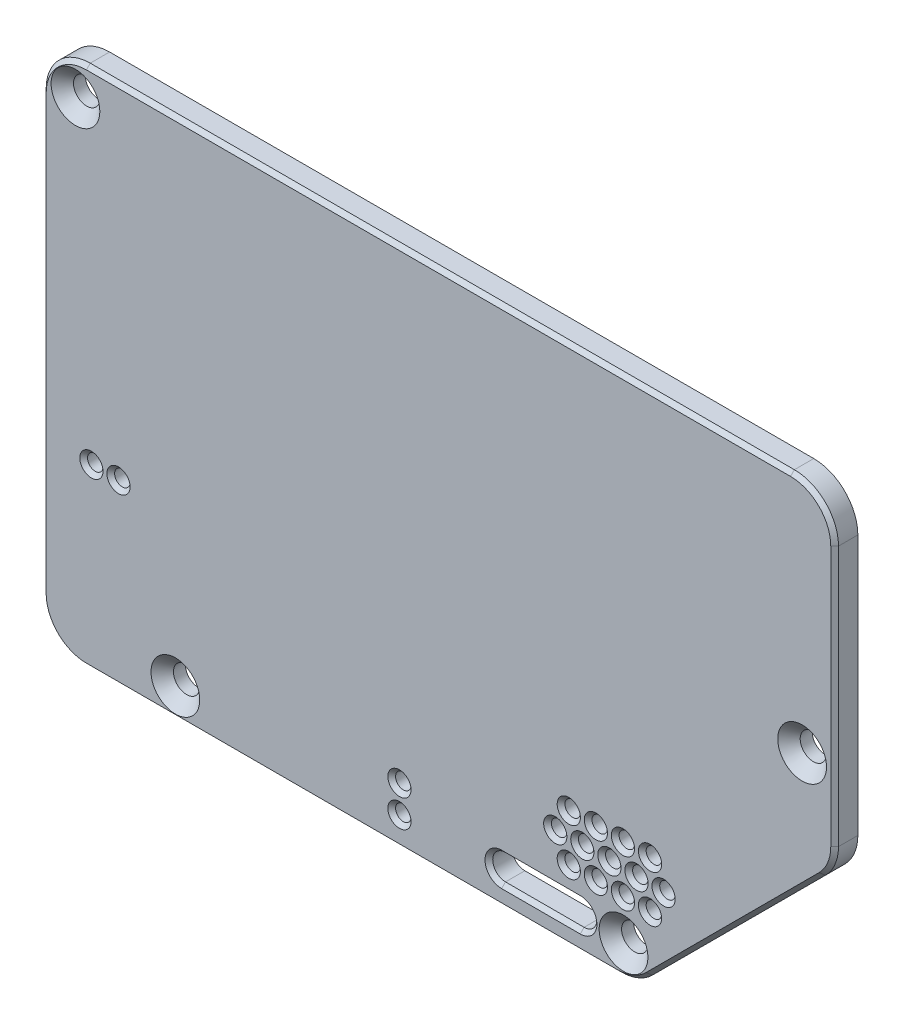
from build123d import *

# Parameters (mm, degrees)
BOSS_EXTRUDE1_DEPTH                            = 3
CSK_FOR_M3_FLAT_HEAD_MACHINE_SCREW1_AT_2_COUNT = 2
CSK_FOR_M3_FLAT_HEAD_MACHINE_SCREW1_AT_2_PITCH = 60.801526997
CSK_FOR_M3_FLAT_HEAD_MACHINE_SCREW1_AT_3_COUNT = 2
CSK_FOR_M3_FLAT_HEAD_MACHINE_SCREW1_AT_3_PITCH = 92.34886737
CSK_FOR_M3_FLAT_HEAD_MACHINE_SCREW1_AT_4_COUNT = 2
CSK_FOR_M3_FLAT_HEAD_MACHINE_SCREW1_AT_4_PITCH = 97.558137473
CUT_EXTRUDE1_DEPTH                             = 121.966441627
SKETCH8_R                                      = 1
CUT_EXTRUDE2_DEPTH                             = 10
SKETCH9_R                                      = 1
CUT_EXTRUDE3_DEPTH                             = 10
SKETCH10_R                                     = 1
CUT_EXTRUDE4_DEPTH                             = 10
CHAMFER1_SIZE                                  = 0.5


with BuildPart() as part:
    # Sketch2 → Boss-Extrude1 (new body)
    with BuildSketch(Plane.XY.offset(8.62)):
        with BuildLine():
            Line((4.5, 66.2), (95.5, 66.2))
            ThreePointArc((95.5, 66.2), (99.530508653, 64.530508653), (101.2, 60.5))
            Line((101.2, 60.5), (101.2, 26.863961031))
            ThreePointArc((101.2, 26.863961031), (100.766113335, 24.682665466), (99.530508653, 22.833452378))
            Line((99.530508653, 22.833452378), (77.166547622, 0.469491347))
            ThreePointArc((77.166547622, 0.469491347), (75.317334534, -0.766113335), (73.136038969, -1.2))
            Line((73.136038969, -1.2), (4.5, -1.2))
            ThreePointArc((4.5, -1.2), (0.469491347, 0.469491347), (-1.2, 4.5))
            Line((-1.2, 4.5), (-1.2, 60.5))
            ThreePointArc((-1.2, 60.5), (0.469491347, 64.530508653), (4.5, 66.2))
        make_face()
    extrude(amount=BOSS_EXTRUDE1_DEPTH)

    # Sketch5 → CSK for M3 Flat Head Machine Screw1 (revolve, cut)
    with BuildSketch(Plane(origin=(3.085786438, 61.914213562, 11.62), x_dir=(0, -1, 0), z_dir=(1, 0, 0))):
        Polygon((0, 0), (0, 3), (1.7, 3), (1.7, 1.45), (3.15, 0), align=None)
    csk_for_m3_flat_head_machine_screw1 = revolve(axis=Axis((3.085786438, 61.914213562, 17.97), (0, 0, -1)), mode=Mode.SUBTRACT)

    # CSK for M3 Flat Head Machine Screw1 at 2: CSK for M3 Flat Head Machine Screw1 ×2
    with Locations(*[Vector(0.21239949389766488, -0.9771829178777205, 0) * (i * CSK_FOR_M3_FLAT_HEAD_MACHINE_SCREW1_AT_2_PITCH) for i in range(1, CSK_FOR_M3_FLAT_HEAD_MACHINE_SCREW1_AT_2_COUNT)]):
        add(csk_for_m3_flat_head_machine_screw1, mode=Mode.SUBTRACT)

    # CSK for M3 Flat Head Machine Screw1 at 3: CSK for M3 Flat Head Machine Screw1 ×2
    with Locations(*[Vector(0.7670014457738275, -0.6416453710429606, 0) * (i * CSK_FOR_M3_FLAT_HEAD_MACHINE_SCREW1_AT_3_PITCH) for i in range(1, CSK_FOR_M3_FLAT_HEAD_MACHINE_SCREW1_AT_3_COUNT)]):
        add(csk_for_m3_flat_head_machine_screw1, mode=Mode.SUBTRACT)

    # CSK for M3 Flat Head Machine Screw1 at 4: CSK for M3 Flat Head Machine Screw1 ×2
    with Locations(*[Vector(0.9626486933350611, -0.27075356548030866, 0) * (i * CSK_FOR_M3_FLAT_HEAD_MACHINE_SCREW1_AT_4_PITCH) for i in range(1, CSK_FOR_M3_FLAT_HEAD_MACHINE_SCREW1_AT_4_COUNT)]):
        add(csk_for_m3_flat_head_machine_screw1, mode=Mode.SUBTRACT)

    # Sketch6 → Cut-Extrude1 (cut, through all)
    with BuildSketch(Plane.XY.offset(11.62)):
        with BuildLine():
            Line((68.326, 1.397), (58.166, 1.397))
            ThreePointArc((58.166, 1.397), (56.515, 3.048), (58.166, 4.699))
            Line((58.166, 4.699), (68.326, 4.699))
            ThreePointArc((68.326, 4.699), (69.977, 3.048), (68.326, 1.397))
        make_face()
    extrude(amount=-CUT_EXTRUDE1_DEPTH, mode=Mode.SUBTRACT)

    # Sketch8 → Cut-Extrude2 (cut)
    with BuildSketch(Plane.XY.offset(11.62)):
        with Locations((44.958, 2.539999994)):
            Circle(SKETCH8_R)
        with Locations((44.958000001, 6.095999994)):
            Circle(SKETCH8_R)
    extrude(amount=-CUT_EXTRUDE2_DEPTH, mode=Mode.SUBTRACT)

    # Sketch9 → Cut-Extrude3 (cut)
    with BuildSketch(Plane.XY.offset(11.62)):
        with Locations((65.093836002, 10.922000001)):
            Circle(SKETCH9_R)
        with Locations((68.593836002, 10.922000001)):
            Circle(SKETCH9_R)
        with Locations((72.093836002, 10.922000001)):
            Circle(SKETCH9_R)
        with Locations((75.593836002, 10.922000001)):
            Circle(SKETCH9_R)
        with Locations((79.093836002, 10.922000001)):
            Circle(SKETCH9_R)
        with Locations((66.843836002, 13.953088914)):
            Circle(SKETCH9_R)
        with Locations((70.343836002, 13.953088914)):
            Circle(SKETCH9_R)
        with Locations((73.843836002, 13.953088914)):
            Circle(SKETCH9_R)
        with Locations((77.343836002, 13.953088914)):
            Circle(SKETCH9_R)
        with Locations((66.843836002, 7.890911087)):
            Circle(SKETCH9_R)
        with Locations((70.343836002, 7.890911087)):
            Circle(SKETCH9_R)
        with Locations((73.843836002, 7.890911087)):
            Circle(SKETCH9_R)
        with Locations((77.343836002, 7.890911087)):
            Circle(SKETCH9_R)
    extrude(amount=-CUT_EXTRUDE3_DEPTH, mode=Mode.SUBTRACT)

    # Sketch10 → Cut-Extrude4 (cut)
    with BuildSketch(Plane.XY.offset(11.62)):
        with Locations((5.147878003, 21.843999999)):
            Circle(SKETCH10_R)
        with Locations((8.647878003, 21.843999999)):
            Circle(SKETCH10_R)
    extrude(amount=-CUT_EXTRUDE4_DEPTH, mode=Mode.SUBTRACT)

    # Chamfer1
    chamfer1_edges = [part.edges().sort_by_distance(p)[0] for p in [
        (76.343836002, 7.890911087, 11.62),
        (78.093836002, 10.922000001, 11.62),
        (76.343836002, 13.953088914, 11.62),
        (74.593836002, 10.922000001, 11.62),
        (72.843836002, 7.890911087, 11.62),
        (72.843836002, 13.953088914, 11.62),
        (71.093836002, 10.922000001, 11.62),
        (69.343836002, 7.890911087, 11.62),
        (69.343836002, 13.953088914, 11.62),
        (43.958, 2.539999994, 11.62),
        (43.958000001, 6.095999994, 11.62),
        (65.843836002, 7.890911087, 11.62),
        (67.593836002, 10.922000001, 11.62),
        (65.843836002, 13.953088914, 11.62),
        (64.093836002, 10.922000001, 11.62),
        (63.246, 1.397, 11.62),
        (69.977, 3.048, 11.62),
        (56.515, 3.048, 11.62),
        (63.246, 4.699, 11.62),
        (101.2, 43.681980515, 11.62),
        (99.530508653, 64.530508653, 11.62),
        (100.766113335, 24.682665466, 11.62),
        (50, 66.2, 11.62),
        (88.348528137, 11.651471863, 11.62),
        (0.469491347, 64.530508653, 11.62),
        (75.317334534, -0.766113335, 11.62),
        (-1.2, 32.5, 11.62),
        (38.818019485, -1.2, 11.62),
        (0.469491347, 0.469491347, 11.62),
        (7.647878003, 21.843999999, 11.62),
        (4.147878003, 21.843999999, 11.62),
    ]]
    chamfer(chamfer1_edges, length=CHAMFER1_SIZE)


solid = part.part
